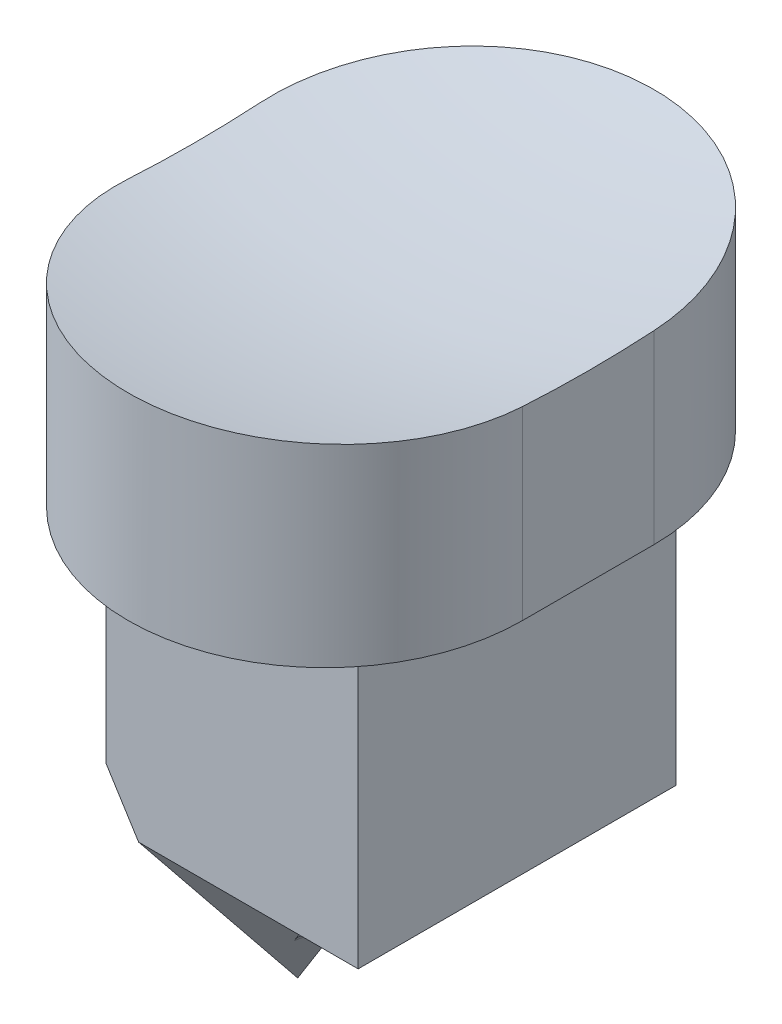
from build123d import *

# Parameters (mm, degrees)
SKETCH1_W               = 19.2
SKETCH1_H               = 24.2
BOSS_EXTRUDE1_DEPTH     = 22.1
BOSS_EXTRUDE2_DEPTH     = 15
BOSS_EXTRUDE3_DEPTH     = 5
BOSS_EXTRUDE4_DEPTH     = 1.5
CHAMFER1_SIZE           = 2.5
FILLET1_R               = 3
SKETCH9_W               = 19.8
SKETCH9_H               = 24.8
SKETCH9_W_2             = 19.2
SKETCH9_H_2             = 24.2
CUT_EXTRUDE_THIN1_DEPTH = 10
SKETCH10_W              = 24.8
SKETCH10_H              = 0.3
CUT_EXTRUDE1_DEPTH      = 19.2
SKETCH12_W              = 19.8
SKETCH12_H              = 24.8
CUT_EXTRUDE3_DEPTH      = 0.3
CHAMFER2_SIZE           = 0.75
CHAMFER3_SIZE           = 0.75
FILLET2_R               = 1


with BuildPart() as part:
    # Sketch1 → Boss-Extrude1 (new body)
    with BuildSketch(Plane(origin=(0, 0, 0), x_dir=(1, 0, 0), z_dir=(0, 1, 0))):
        Rectangle(SKETCH1_W, SKETCH1_H)
    extrude(amount=BOSS_EXTRUDE1_DEPTH)

    # Sketch2 → Boss-Extrude2 (add)
    with BuildSketch(Plane(origin=(0, 22.1, 0), x_dir=(1, 0, 0), z_dir=(0, 1, 0))):
        with BuildLine():
            Line((15, 5), (15, -5))
            ThreePointArc((15, -5), (0, -20), (-15, -5))
            Line((-15, -5), (-15, 5))
            ThreePointArc((-15, 5), (0, 20), (15, 5))
        make_face()
    extrude(amount=BOSS_EXTRUDE2_DEPTH)

    # Sketch4 → Boss-Extrude3 (add)
    with BuildSketch(Plane.ZY.offset(9.6)):
        Polygon((-12.1, 0), (0, -15), (12.1, 0), align=None)
    extrude(amount=-BOSS_EXTRUDE3_DEPTH)

    # Sketch6 → Boss-Extrude4 (add, symmetric)
    with BuildSketch(Plane.XY):
        Polygon((-4.6, -10), (9.6, 0), (-4.6, 0), align=None)
    extrude(amount=BOSS_EXTRUDE4_DEPTH, both=True)

    # Chamfer1
    # the kernel refuses this chamfer: 2.5 mm, written as the material it takes off along each edge
    with BuildSketch(Plane(origin=(-9.6, 5.004053029, -16.136602777), x_dir=(-0.02749587661058631, 0.6276164868252809, 0.7780369671387777), z_dir=(0, -0.7783312410184162, 0.6278538677548561)), Plane(origin=(-9.6, -20.004053029, -4.036602777), x_dir=(-0.027495876610586317, 0.6276164868252805, -0.778036967138778), z_dir=(0, 0.7783312410184164, 0.6278538677548556))) as chamfer1_piece_1:
        Polygon((CHAMFER1_SIZE * 0.999621916911, -CHAMFER1_SIZE * 0.0274958766106), (-CHAMFER1_SIZE * 0.0274958766106, -CHAMFER1_SIZE * 0.999621916911), (0, 0), align=None)
    extrude(amount=32.130415355, mode=Mode.SUBTRACT)
    with BuildSketch(Plane(origin=(-4.6, 5.004053029, -16.136602777), x_dir=(-0.9996219169112968, -0.017263392477266982, -0.02140089976520685), z_dir=(0, -0.7783312410184162, 0.6278538677548561))) as chamfer1_piece_2_section:
        Polygon((CHAMFER1_SIZE * 0.999621916911, -CHAMFER1_SIZE * 0.0274958766106), (-CHAMFER1_SIZE * 0.0274958766106, -CHAMFER1_SIZE * 0.999621916911), (0, 0), align=None)
    chamfer1_piece_2 = extrude(amount=32.130415355, mode=Mode.PRIVATE)
    chamfer1_piece_2 = split(chamfer1_piece_2, bisect_by=Plane(origin=(-5.457746671, 0, -6.779130054), z_dir=(0, -1, 0)), keep=Keep.TOP, mode=Mode.PRIVATE)
    chamfer1_piece_2 = split(chamfer1_piece_2, bisect_by=Plane(origin=(-5.457746671, -5.291671114, -1.5), z_dir=(0, 0, -1)), keep=Keep.TOP, mode=Mode.PRIVATE)
    add(chamfer1_piece_2, mode=Mode.SUBTRACT)
    with BuildSketch(Plane(origin=(-4.6, 5.004053029, -16.136602777), x_dir=(-0.9996219169112968, -0.017263392477266982, -0.02140089976520685), z_dir=(0, -0.7783312410184162, 0.6278538677548561))) as chamfer1_piece_3_section:
        Polygon((CHAMFER1_SIZE * 0.999621916911, -CHAMFER1_SIZE * 0.0274958766106), (-CHAMFER1_SIZE * 0.0274958766106, -CHAMFER1_SIZE * 0.999621916911), (0, 0), align=None)
    chamfer1_piece_3 = extrude(amount=32.130415355, mode=Mode.PRIVATE)
    chamfer1_piece_3 = split(chamfer1_piece_3, bisect_by=Plane(origin=(-6.522169722, -11.35364065, -0.439205928), z_dir=(0.5757786192909291, -0.8176056393931194, 0)), keep=Keep.TOP, mode=Mode.PRIVATE)
    add(chamfer1_piece_3, mode=Mode.SUBTRACT)
    with BuildSketch(Plane(origin=(-4.6, -20.004053029, -4.036602777), x_dir=(-0.9996219169112968, -0.017263392477266715, 0.021400899765206826), z_dir=(0, 0.7783312410184164, 0.6278538677548556))) as chamfer1_piece_4_section:
        Polygon((CHAMFER1_SIZE * 0.999621916911, -CHAMFER1_SIZE * 0.0274958766106), (-CHAMFER1_SIZE * 0.0274958766106, -CHAMFER1_SIZE * 0.999621916911), (0, 0), align=None)
    chamfer1_piece_4 = extrude(amount=32.130415355, mode=Mode.PRIVATE)
    chamfer1_piece_4 = split(chamfer1_piece_4, bisect_by=Plane(origin=(-6.522169722, -11.35364065, 0.439205928), z_dir=(0.5757786192909291, -0.8176056393931194, 0)), keep=Keep.TOP, mode=Mode.PRIVATE)
    add(chamfer1_piece_4, mode=Mode.SUBTRACT)
    with BuildSketch(Plane(origin=(-4.6, -20.004053029, -4.036602777), x_dir=(-0.9996219169112968, -0.017263392477266715, 0.021400899765206826), z_dir=(0, 0.7783312410184164, 0.6278538677548556))) as chamfer1_piece_5_section:
        Polygon((CHAMFER1_SIZE * 0.999621916911, -CHAMFER1_SIZE * 0.0274958766106), (-CHAMFER1_SIZE * 0.0274958766106, -CHAMFER1_SIZE * 0.999621916911), (0, 0), align=None)
    chamfer1_piece_5 = extrude(amount=32.130415355, mode=Mode.PRIVATE)
    chamfer1_piece_5 = split(chamfer1_piece_5, bisect_by=Plane(origin=(-5.457746671, 0, 6.779130054), z_dir=(0, -1, 0)), keep=Keep.TOP, mode=Mode.PRIVATE)
    chamfer1_piece_5 = split(chamfer1_piece_5, bisect_by=Plane(origin=(-5.457746671, -5.291671114, 1.5), z_dir=(0, 0, 1)), keep=Keep.TOP, mode=Mode.PRIVATE)
    add(chamfer1_piece_5, mode=Mode.SUBTRACT)

    # Fillet1
    fillet1_edges = [part.edges().sort_by_distance(p)[0] for p in [
        (-4.6, 0, -5.193999965),
        (-4.6, 0, 5.193999965),
    ]]
    fillet(fillet1_edges, radius=FILLET1_R)

    # Sketch8 → Cut-Revolve3 (revolve, cut)
    with BuildSketch(Plane(origin=(0, 0, 0), x_dir=(0, 0, -1), z_dir=(1, 0, 0))):
        with BuildLine():
            Line((-85.278426346, 120), (85.278426346, 120))
            ThreePointArc((85.278426346, 120), (0, 34.721573654), (-85.278426346, 120))
        make_face()
    revolve(axis=Axis((0, 120, 85.278426346), (0, 0, -1)), mode=Mode.SUBTRACT)

    # Sketch9 → Cut-Extrude-Thin1 (cut)
    with BuildSketch(Plane.XZ.offset(-22.1)):
        Rectangle(SKETCH9_W, SKETCH9_H)
        Rectangle(SKETCH9_W_2, SKETCH9_H_2, mode=Mode.SUBTRACT)
    extrude(amount=-CUT_EXTRUDE_THIN1_DEPTH, mode=Mode.SUBTRACT)

    # Sketch10 → Cut-Extrude1 (cut)
    with BuildSketch(Plane.ZY.offset(9.6)):
        with Locations((0, 32.25)):
            Rectangle(SKETCH10_W, SKETCH10_H)
    extrude(amount=-CUT_EXTRUDE1_DEPTH, mode=Mode.SUBTRACT)


with BuildPart() as cut_extrude1_piece_1:
    # of the separate pieces the step leaves, piece 1, a body of its own (cut_extrude1_pieces)
    add(part.part.solids().sort_by_distance((-4.6, -3, -6.467999931))[0])

    # Chamfer3
    chamfer3_edges = [cut_extrude1_piece_1.edges().sort_by_distance(p)[0] for p in [
        (0, 32.1, -12.1),
        (9.6, 32.1, 0),
        (0, 32.1, 12.1),
        (-9.6, 32.1, 0),
    ]]
    chamfer(chamfer3_edges, length=CHAMFER3_SIZE)

    # Fillet2
    fillet2_edges = [cut_extrude1_piece_1.edges().sort_by_distance(p)[0] for p in [
        (-4.6, -10, 0),
        (-5.073449943, -10.333415453, -1.160666632),
        (-5.073449943, -10.333415453, 1.160666632),
    ]]
    fillet(fillet2_edges, radius=FILLET2_R)


with BuildPart() as cut_extrude1_piece_2:
    # of the separate pieces the step leaves, piece 2, a body of its own (cut_extrude1_pieces)
    add(part.part.solids().sort_by_distance((9.9, 32.1, 12.4))[0])

    # Sketch12 → Cut-Extrude3 (cut)
    with BuildSketch(Plane.XZ.offset(-32.1)):
        Rectangle(SKETCH12_W, SKETCH12_H)
    extrude(amount=-CUT_EXTRUDE3_DEPTH, mode=Mode.SUBTRACT)

    # Chamfer2
    chamfer2_edges = [cut_extrude1_piece_2.edges().sort_by_distance(p)[0] for p in [
        (9.9, 22.1, 0),
        (0, 22.1, -12.4),
        (-9.9, 22.1, 0),
        (0, 22.1, 12.4),
    ]]
    chamfer(chamfer2_edges, length=CHAMFER2_SIZE)


solid = Compound([cut_extrude1_piece_1.part, cut_extrude1_piece_2.part])
